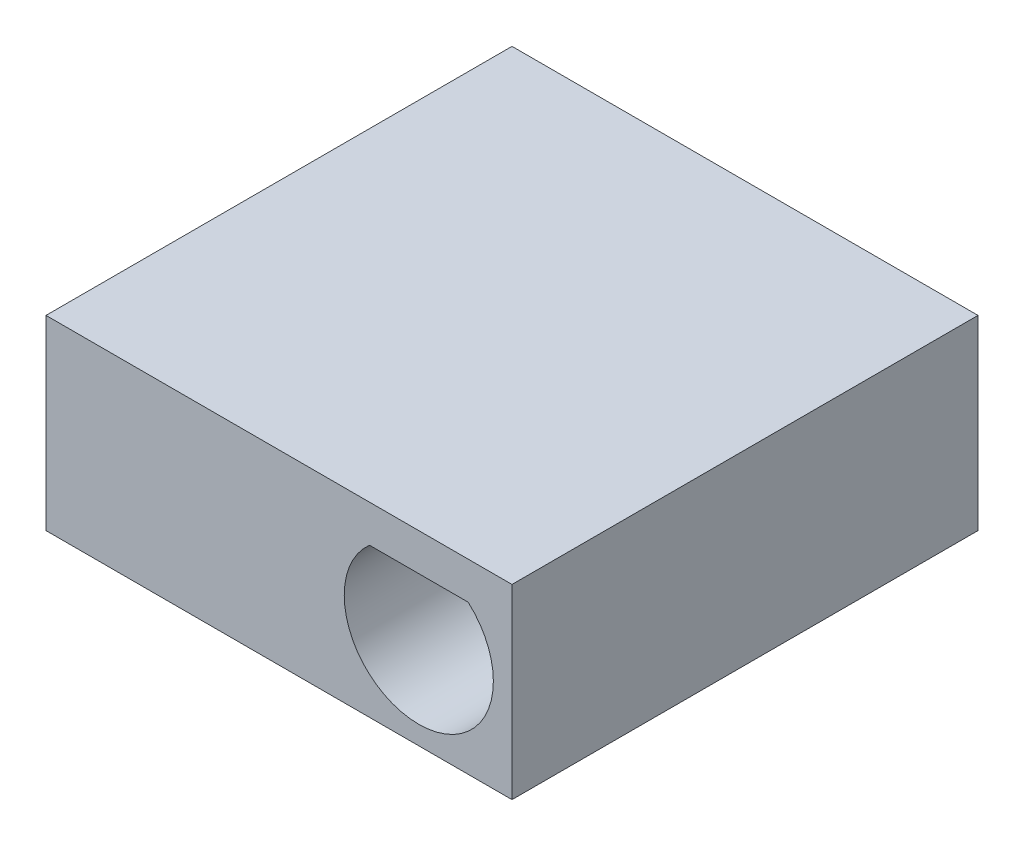
from build123d import *

# Parameters (mm, degrees)
SKETCH1_W           = 25
SKETCH1_H           = 25
BOSS_EXTRUDE1_DEPTH = 10
CUT_EXTRUDE1_DEPTH  = 10


with BuildPart() as part:
    # Sketch1 → Boss-Extrude1 (new body)
    with BuildSketch(Plane(origin=(0, 0, 0), x_dir=(1, 0, 0), z_dir=(0, 1, 0))):
        Rectangle(SKETCH1_W, SKETCH1_H)
    extrude(amount=BOSS_EXTRUDE1_DEPTH)

    # Sketch2 → Cut-Extrude1 (cut)
    with BuildSketch(Plane.XY.offset(12.5)):
        with BuildLine():
            Line((4.854248689, 8), (10.145751311, 8))
            ThreePointArc((10.145751311, 8), (7.5, 1), (4.854248689, 8))
        make_face()
    extrude(amount=-CUT_EXTRUDE1_DEPTH, mode=Mode.SUBTRACT)


solid = part.part
